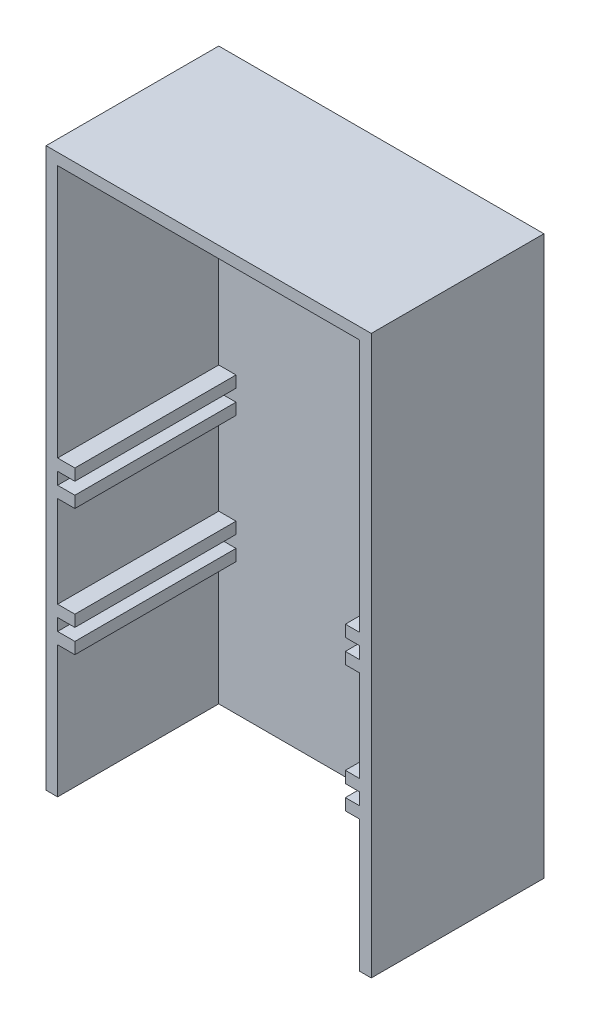
from build123d import *

# Parameters (mm, degrees)
SKETCH1_W               = 56.5
SKETCH1_H               = 100
BOSS_EXTRUDE1_DEPTH     = 30
SHELL1_T                = -2
SKETCH2_W               = 52.5
SKETCH2_H               = 2
BOSS_EXTRUDE2_DEPTH     = 26
CUT_EXTRUDE5_DEPTH      = 3
SKETCH6_W               = 30
SKETCH6_H               = 2
BOSS_EXTRUDE3_DEPTH     = 3
SKETCH7_W               = 30
SKETCH7_H               = 2
BOSS_EXTRUDE4_DEPTH     = 3
MIRROR2_COPY_1_SKETCH_W = 30
MIRROR2_COPY_1_SKETCH_H = 2
MIRROR2_COPY_1_DEPTH    = 3
MIRROR2_COPY_2_SKETCH_W = 30
MIRROR2_COPY_2_SKETCH_H = 2
MIRROR2_COPY_2_DEPTH    = 3
SKETCH8_W               = 56.5
SKETCH8_H               = 30
CUT_EXTRUDE6_DEPTH      = 3


with BuildPart() as part:
    # Sketch1 → Boss-Extrude1 (new body)
    with BuildSketch(Plane.XY):
        with Locations((-28.25, 50)):
            Rectangle(SKETCH1_W, SKETCH1_H)
    extrude(amount=BOSS_EXTRUDE1_DEPTH)

    # Shell1
    shell1_openings = [part.faces().sort_by_distance(p)[0] for p in [
        (-28.25, 50, 30),
    ]]
    offset(amount=SHELL1_T, openings=shell1_openings, kind=Kind.INTERSECTION)

    # Sketch2 → Boss-Extrude2 (add)
    with BuildSketch(Plane.XY.offset(2)):
        with Locations((-28.25, 97)):
            Rectangle(SKETCH2_W, SKETCH2_H)
    extrude(amount=BOSS_EXTRUDE2_DEPTH)

    # Sketch3 → Cut-Extrude5 (cut)
    with BuildSketch(Plane.XZ.offset(-96)):
        with BuildLine():
            Line((-36.35, 28), (-20.15, 28))
            ThreePointArc((-20.15, 28), (-28.25, 19.9), (-36.35, 28))
        make_face()
    extrude(amount=-CUT_EXTRUDE5_DEPTH, mode=Mode.SUBTRACT)

    # Sketch6 → Boss-Extrude3 (add)
    with BuildSketch(Plane(origin=(-54.5, 0, 0), x_dir=(0, 0, -1), z_dir=(1, 0, 0))):
        with Locations((-15, 53)):
            Rectangle(SKETCH6_W, SKETCH6_H)
    boss_extrude3 = extrude(amount=BOSS_EXTRUDE3_DEPTH)

    # Sketch7 → Boss-Extrude4 (add)
    with BuildSketch(Plane(origin=(-54.5, 0, 0), x_dir=(0, 0, -1), z_dir=(1, 0, 0))):
        with Locations((-15, 48.9)):
            Rectangle(SKETCH7_W, SKETCH7_H)
    boss_extrude4 = extrude(amount=BOSS_EXTRUDE4_DEPTH)

    # Mirror1: Boss-Extrude3, Boss-Extrude4 across plane
    add(boss_extrude3.mirror(Plane(origin=(-28, 0, 0), x_dir=(0, 0, 1), z_dir=(1, 0, 0))))
    add(boss_extrude4.mirror(Plane(origin=(-28, 0, 0), x_dir=(0, 0, 1), z_dir=(1, 0, 0))))

    # Mirror2: Boss-Extrude3, Boss-Extrude4 across plane
    add(boss_extrude3.mirror(Plane(origin=(0, 39.95, 0), x_dir=(0, 0, 1), z_dir=(0, -1, 0))))
    add(boss_extrude4.mirror(Plane(origin=(0, 39.95, 0), x_dir=(0, 0, 1), z_dir=(0, -1, 0))))

    # Mirror2 copy 1 sketch → Mirror2 copy 1 (add)
    with BuildSketch(Plane(origin=(-1.5, 79.9, 0), x_dir=(0, 0, -1), z_dir=(-1, 0, 0))):
        with Locations((-15, 53)):
            Rectangle(MIRROR2_COPY_1_SKETCH_W, MIRROR2_COPY_1_SKETCH_H)
    extrude(amount=MIRROR2_COPY_1_DEPTH)

    # Mirror2 copy 2 sketch → Mirror2 copy 2 (add)
    with BuildSketch(Plane(origin=(-1.5, 79.9, 0), x_dir=(0, 0, -1), z_dir=(-1, 0, 0))):
        with Locations((-15, 48.9)):
            Rectangle(MIRROR2_COPY_2_SKETCH_W, MIRROR2_COPY_2_SKETCH_H)
    extrude(amount=MIRROR2_COPY_2_DEPTH)

    # Sketch8 → Cut-Extrude6 (cut)
    with BuildSketch(Plane.XZ):
        with Locations((-28.25, 15)):
            Rectangle(SKETCH8_W, SKETCH8_H)
    extrude(amount=-CUT_EXTRUDE6_DEPTH, mode=Mode.SUBTRACT)


solid = part.part
